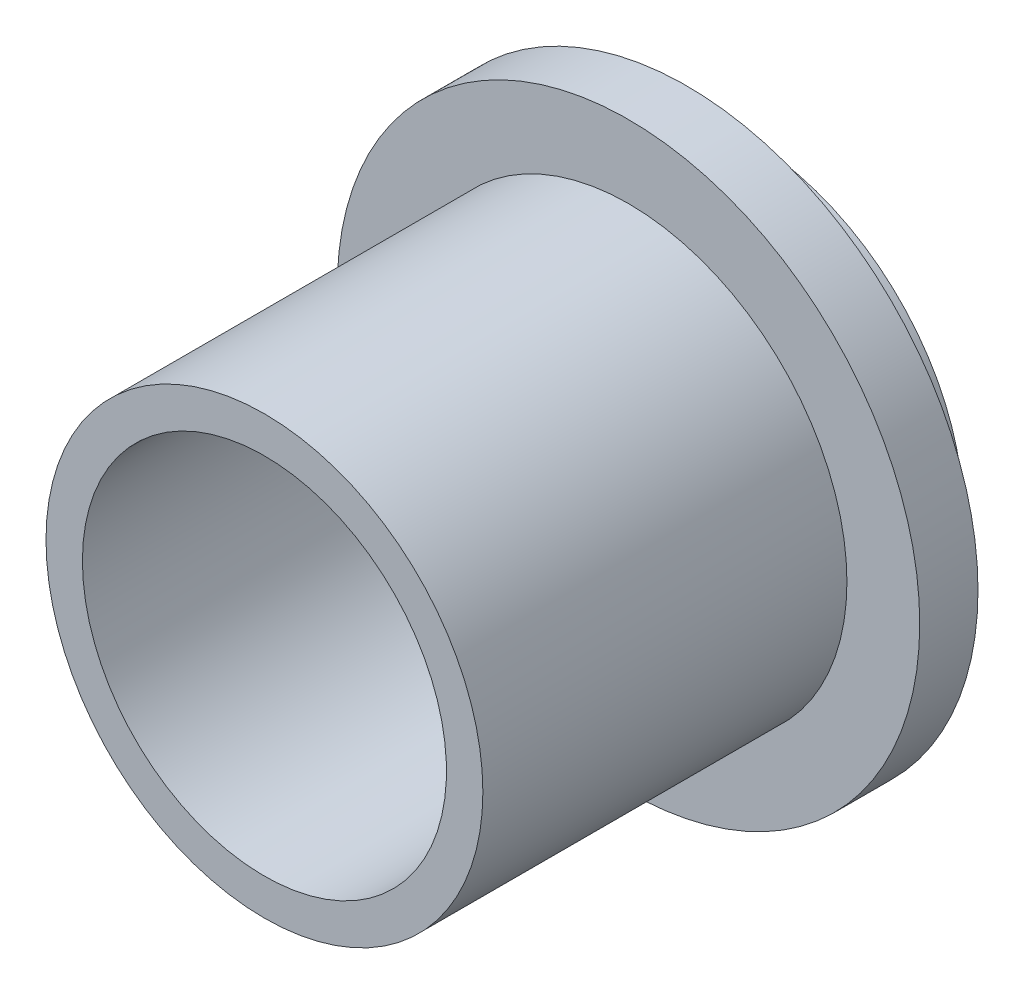
from build123d import *
from build123d.topology import SkipClean

# Parameters (mm, degrees)
SKETCH1_R               = 38.1
SKETCH1_R_2             = 31.75
BOSS_EXTRUDE1_DEPTH     = 63.5
SKETCH2_R               = 50.8
BOSS_EXTRUDE2_DEPTH     = 10.16
CUT_EXTRUDE2_DEPTH      = 53.34
CUT_EXTRUDE2_DEPTH_BACK = 96.882897328
SKETCH3_R               = 31.75
BOSS_EXTRUDE3_START     = 10.16
SKETCH4_R               = 38.1
SKETCH4_R_2             = 31.75
BOSS_EXTRUDE3_DEPTH     = 10.16


with BuildPart() as part:
    # Sketch1 → Boss-Extrude1 (new body)
    with BuildSketch(Plane.XY):
        Circle(SKETCH1_R)
        Circle(SKETCH1_R_2, mode=Mode.SUBTRACT)
    extrude(amount=BOSS_EXTRUDE1_DEPTH)

    # Sketch2 → Boss-Extrude2 (add)
    with BuildSketch(Plane(origin=(0, 0, 0), x_dir=(-1, 0, 0), z_dir=(0, 0, -1))):
        Circle(SKETCH2_R)
    extrude(amount=BOSS_EXTRUDE2_DEPTH)

    # Sketch3 → Cut-Extrude2 (cut, two sides: drawn at the far end of the back side and taken through both)
    with SkipClean():  # the faces are left unmerged after this step: merging them gives an invalid solid
        with BuildSketch(Plane(origin=(0, 0, 0), x_dir=(-1, 0, 0), z_dir=(0, 0, -1)).offset(-CUT_EXTRUDE2_DEPTH_BACK)):
            Circle(SKETCH3_R)
        extrude(amount=CUT_EXTRUDE2_DEPTH + CUT_EXTRUDE2_DEPTH_BACK, mode=Mode.SUBTRACT)
    add(part.part.scale(1), mode=Mode.REPLACE)  # the faces are merged on a copy

    # Sketch4 → Boss-Extrude3 (add)
    with BuildSketch(Plane(origin=(0, 0, -10.16), x_dir=(-1, 0, 0), z_dir=(0, 0, -1)).offset(BOSS_EXTRUDE3_START)):
        Circle(SKETCH4_R)
        Circle(SKETCH4_R_2, mode=Mode.SUBTRACT)
    extrude(amount=-BOSS_EXTRUDE3_DEPTH)


solid = part.part
